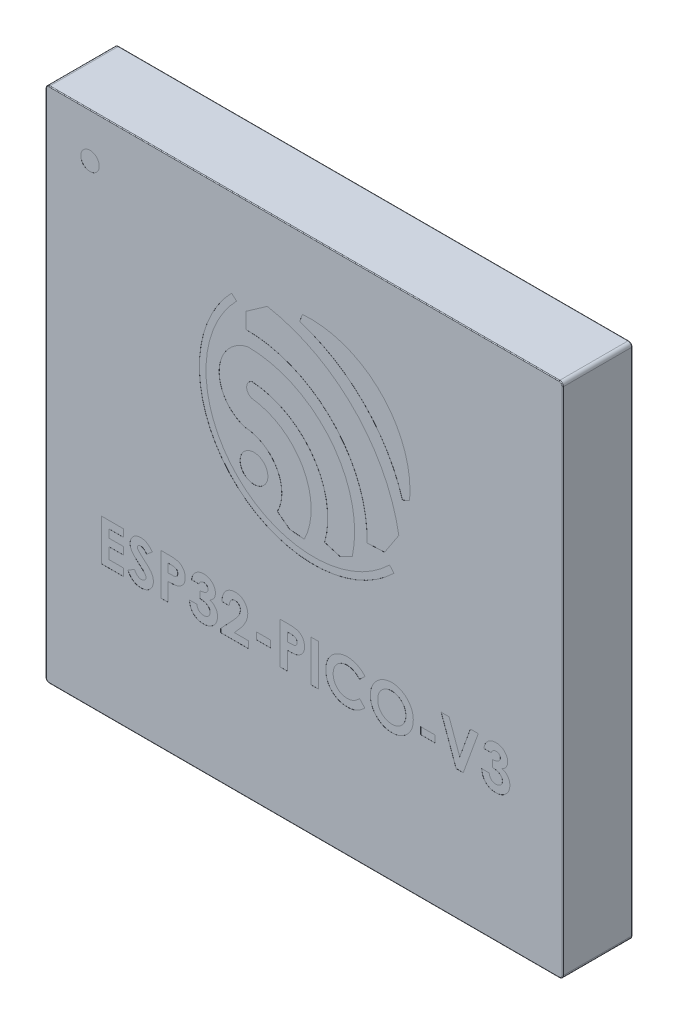
from build123d import *

# Parameters (mm, degrees)
SKETCH1_W             = 7
SKETCH1_H             = 7
BOSS_EXTRUDE1_DEPTH   = 0.94
FILLET1_R             = 0.05
FILLET2_R             = 0.01
SKETCH2_W             = 0.25
SKETCH2_H             = 0.4
SKETCH2_W_2           = 0.4
SKETCH2_H_2           = 0.25
BOSS_EXTRUDE2_DEPTH   = 0.025
SKETCH3_R             = 0.125
SKETCH3_R_2           = 0.188076001
SKETCH3_W             = 0.193846154
SKETCH3_H             = 0.093333333
SKETCH3_W_2           = 0.10051282
SKETCH3_H_2           = 0.56
CUT_EXTRUDE1_DEPTH    = 0.001
BODY_MOVE_COPY1_ANGLE = 180


with BuildPart() as part:
    # Sketch1 → Boss-Extrude1 (new body)
    with BuildSketch(Plane(origin=(0, 0, 0), x_dir=(1, 0, 0), z_dir=(0, 1, 0))):
        Rectangle(SKETCH1_W, SKETCH1_H)
    extrude(amount=BOSS_EXTRUDE1_DEPTH)

    # Fillet1
    fillet1_edges = [part.edges().sort_by_distance(p)[0] for p in [
        (3.5, 0.47, -3.5),
        (3.5, 0.47, 3.5),
        (-3.5, 0.47, 3.5),
        (-3.5, 0.47, -3.5),
    ]]
    fillet(fillet1_edges, radius=FILLET1_R)

    # Fillet2
    fillet2_edges = [part.edges().sort_by_distance(p)[0] for p in [
        (3.485355339, 0.94, 3.485355339),
        (0, 0.94, 3.5),
        (-3.485355339, 0.94, 3.485355339),
        (-3.5, 0.94, 0),
        (-3.485355339, 0.94, -3.485355339),
        (0, 0.94, -3.5),
        (3.485355339, 0.94, -3.485355339),
        (3.5, 0.94, 0),
        (3.5, 0, 0),
        (3.485355339, 0, -3.485355339),
        (0, 0, -3.5),
        (3.485355339, 0, 3.485355339),
        (0, 0, 3.5),
        (-3.485355339, 0, 3.485355339),
        (-3.5, 0, 0),
        (-3.485355339, 0, -3.485355339),
    ]]
    fillet(fillet2_edges, radius=FILLET2_R)

    # Sketch2 → Boss-Extrude2 (add)
    with BuildSketch(Plane.XZ):
        with BuildLine():
            Line((2.175, 2.475), (2.475, 2.175))
            Line((2.475, 2.175), (2.475, -2.425))
            ThreePointArc((2.475, -2.425), (2.460355339, -2.460355339), (2.425, -2.475))
            Line((2.425, -2.475), (-2.425, -2.475))
            ThreePointArc((-2.425, -2.475), (-2.460355339, -2.460355339), (-2.475, -2.425))
            Line((-2.475, -2.425), (-2.475, 2.425))
            ThreePointArc((-2.475, 2.425), (-2.460355339, 2.460355339), (-2.425, 2.475))
            Line((-2.425, 2.475), (2.175, 2.475))
        make_face()
        with Locations((-0.25, 3.225)):
            Rectangle(SKETCH2_W, SKETCH2_H)
        with Locations((-0.75, 3.225)):
            Rectangle(SKETCH2_W, SKETCH2_H)
        with Locations((-1.25, 3.225)):
            Rectangle(SKETCH2_W, SKETCH2_H)
        with Locations((-1.75, 3.225)):
            Rectangle(SKETCH2_W, SKETCH2_H)
        with Locations((-2.25, 3.225)):
            Rectangle(SKETCH2_W, SKETCH2_H)
        with Locations((-2.75, 3.225)):
            Rectangle(SKETCH2_W, SKETCH2_H)
        with Locations((2.75, 3.225)):
            Rectangle(SKETCH2_W, SKETCH2_H)
        with Locations((2.25, 3.225)):
            Rectangle(SKETCH2_W, SKETCH2_H)
        with Locations((1.75, 3.225)):
            Rectangle(SKETCH2_W, SKETCH2_H)
        with Locations((1.25, 3.225)):
            Rectangle(SKETCH2_W, SKETCH2_H)
        with Locations((0.75, 3.225)):
            Rectangle(SKETCH2_W, SKETCH2_H)
        with Locations((0.25, 3.225)):
            Rectangle(SKETCH2_W, SKETCH2_H)
        with Locations((0.25, -3.225)):
            Rectangle(SKETCH2_W, SKETCH2_H)
        with Locations((0.75, -3.225)):
            Rectangle(SKETCH2_W, SKETCH2_H)
        with Locations((1.25, -3.225)):
            Rectangle(SKETCH2_W, SKETCH2_H)
        with Locations((1.75, -3.225)):
            Rectangle(SKETCH2_W, SKETCH2_H)
        with Locations((2.25, -3.225)):
            Rectangle(SKETCH2_W, SKETCH2_H)
        with Locations((2.75, -3.225)):
            Rectangle(SKETCH2_W, SKETCH2_H)
        with Locations((-2.75, -3.225)):
            Rectangle(SKETCH2_W, SKETCH2_H)
        with Locations((-2.25, -3.225)):
            Rectangle(SKETCH2_W, SKETCH2_H)
        with Locations((-1.75, -3.225)):
            Rectangle(SKETCH2_W, SKETCH2_H)
        with Locations((-1.25, -3.225)):
            Rectangle(SKETCH2_W, SKETCH2_H)
        with Locations((-0.75, -3.225)):
            Rectangle(SKETCH2_W, SKETCH2_H)
        with Locations((-0.25, -3.225)):
            Rectangle(SKETCH2_W, SKETCH2_H)
        with Locations((3.225, 0.25)):
            Rectangle(SKETCH2_W_2, SKETCH2_H_2)
        with Locations((3.225, 0.75)):
            Rectangle(SKETCH2_W_2, SKETCH2_H_2)
        with Locations((3.225, 1.25)):
            Rectangle(SKETCH2_W_2, SKETCH2_H_2)
        with Locations((3.225, 1.75)):
            Rectangle(SKETCH2_W_2, SKETCH2_H_2)
        with Locations((3.225, 2.25)):
            Rectangle(SKETCH2_W_2, SKETCH2_H_2)
        with Locations((3.225, 2.75)):
            Rectangle(SKETCH2_W_2, SKETCH2_H_2)
        with Locations((3.225, -2.75)):
            Rectangle(SKETCH2_W_2, SKETCH2_H_2)
        with Locations((3.225, -2.25)):
            Rectangle(SKETCH2_W_2, SKETCH2_H_2)
        with Locations((3.225, -1.75)):
            Rectangle(SKETCH2_W_2, SKETCH2_H_2)
        with Locations((3.225, -1.25)):
            Rectangle(SKETCH2_W_2, SKETCH2_H_2)
        with Locations((3.225, -0.75)):
            Rectangle(SKETCH2_W_2, SKETCH2_H_2)
        with Locations((3.225, -0.25)):
            Rectangle(SKETCH2_W_2, SKETCH2_H_2)
        with Locations((-3.225, -0.25)):
            Rectangle(SKETCH2_W_2, SKETCH2_H_2)
        with Locations((-3.225, -0.75)):
            Rectangle(SKETCH2_W_2, SKETCH2_H_2)
        with Locations((-3.225, -1.25)):
            Rectangle(SKETCH2_W_2, SKETCH2_H_2)
        with Locations((-3.225, -1.75)):
            Rectangle(SKETCH2_W_2, SKETCH2_H_2)
        with Locations((-3.225, -2.25)):
            Rectangle(SKETCH2_W_2, SKETCH2_H_2)
        with Locations((-3.225, -2.75)):
            Rectangle(SKETCH2_W_2, SKETCH2_H_2)
        with Locations((-3.225, 2.75)):
            Rectangle(SKETCH2_W_2, SKETCH2_H_2)
        with Locations((-3.225, 2.25)):
            Rectangle(SKETCH2_W_2, SKETCH2_H_2)
        with Locations((-3.225, 1.75)):
            Rectangle(SKETCH2_W_2, SKETCH2_H_2)
        with Locations((-3.225, 1.25)):
            Rectangle(SKETCH2_W_2, SKETCH2_H_2)
        with Locations((-3.225, 0.75)):
            Rectangle(SKETCH2_W_2, SKETCH2_H_2)
        with Locations((-3.225, 0.25)):
            Rectangle(SKETCH2_W_2, SKETCH2_H_2)
    extrude(amount=BOSS_EXTRUDE2_DEPTH)

    # Sketch3 → Cut-Extrude1 (cut)
    # profile 1 of 19: a face of its own
    with BuildSketch(Plane(origin=(0, 0.94, 0), x_dir=(1, 0, 0), z_dir=(0, 1, 0))):
        with Locations((2.9, -2.9)):
            Circle(SKETCH3_R)
    # profile 2 of 19: a face of its own
    with BuildSketch(Plane(origin=(0, 0.94, 0), x_dir=(1, 0, 0), z_dir=(0, 1, 0))):
        with Locations((0.680465869, -0.405591689)):
            Circle(SKETCH3_R_2)
    # profile 3 of 19: a face of its own
    with BuildSketch(Plane(origin=(0, 0.94, 0), x_dir=(1, 0, 0), z_dir=(0, 1, 0))):
        with BuildLine():
            Line((-1.329066131, -1.038515513), (-1.425708131, -1.079675513))
            ThreePointArc((-1.425708131, -1.079675513), (-1.039396996, -2.146594255), (0.025516006, -2.538400574))
            Line((0.025516006, -2.538400574), (0.062351869, -2.435729513))
            ThreePointArc((0.062351869, -2.435729513), (-0.807548499, -1.910591291), (-1.329066131, -1.038515513))
        make_face()
    # profile 4 of 19: a face of its own
    with BuildSketch(Plane(origin=(0, 0.94, 0), x_dir=(1, 0, 0), z_dir=(0, 1, 0))):
        with BuildLine():
            Line((-0.849006132, -0.296668387), (-1.087188132, -0.306874387))
            Line((-1.087188132, -0.306874387), (-1.279674132, -0.600748387))
            ThreePointArc((-1.279674132, -0.600748387), (-0.671967645, -1.778283582), (0.500946606, -2.394861614))
            Line((0.500946606, -2.394861614), (0.789906606, -2.192127614))
            Line((0.789906606, -2.192127614), (0.789906606, -1.979145614))
            ThreePointArc((0.789906606, -1.979145614), (-0.384973249, -1.484127484), (-0.849006132, -0.296668387))
        make_face()
    # profile 5 of 19: a face of its own
    with BuildSketch(Plane(origin=(0, 0.94, 0), x_dir=(1, 0, 0), z_dir=(0, 1, 0))):
        with BuildLine():
            Line((0.916505869, -2.248829513), (0.983831869, -2.308385513))
            ThreePointArc((0.983831869, -2.308385513), (0.962870462, -0.13150162), (-1.214102193, -0.124226816))
            Line((-1.214102193, -0.124226816), (-1.154228408, -0.191279923))
            ThreePointArc((-1.154228408, -0.191279923), (0.899527006, -0.195140655), (0.916505869, -2.248829513))
        make_face()
    # profile 6 of 19: a face of its own
    with BuildSketch(Plane(origin=(0, 0.94, 0), x_dir=(1, 0, 0), z_dir=(0, 1, 0))):
        with BuildLine():
            Line((0.364251232, -0.058565655), (0.198519232, 0.066846345))
            Line((0.198519232, 0.066846345), (-0.000476768, 0.084360345))
            ThreePointArc((-0.000476768, 0.084360345), (0.017660774, -0.747935784), (0.709197662, -1.21142532))
            ThreePointArc((0.709197662, -1.21142532), (0.779600706, -1.311524275), (0.705482082, -1.408904042))
            ThreePointArc((0.705482082, -1.408904042), (-0.118148182, -0.947937237), (-0.275155251, -0.017235357))
            Line((-0.275155251, -0.017235357), (-0.485491251, 0.045386643))
            Line((-0.485491251, 0.045386643), (-0.649358418, -0.036630846))
            ThreePointArc((-0.649358418, -0.036630846), (-0.360274374, -1.25078894), (0.765772749, -1.789089357))
            ThreePointArc((0.765772749, -1.789089357), (1.152134339, -1.323910603), (0.807057077, -0.827334089))
            ThreePointArc((0.807057077, -0.827334089), (0.374300948, -0.564688007), (0.364251232, -0.058565655))
        make_face()
    # profile 7 of 19: a face of its own
    with BuildSketch(Plane(origin=(0, 0.94, 0), x_dir=(1, 0, 0), z_dir=(0, 1, 0))):
        with BuildLine():
            Line((-2.530769231, 1.321410256), (-2.43025641, 1.321410256))
            add(Edge.make_bspline(
                [(-2.43025641, 1.321410256), (-2.430961642, 1.31638488), (-2.432339134, 1.306569075), (-2.435725388, 1.29232424), (-2.439641386, 1.278778454), (-2.444649393, 1.266004411), (-2.450430234, 1.254015882), (-2.457171479, 1.242802139), (-2.46456033, 1.232202256), (-2.470345338, 1.225850074), (-2.473221154, 1.222692308)],
                knots=[0, 0, 0, 0, 1.1115466, 2.171125598, 3.205689823, 4.19946166, 5.17440286, 6.118867946, 7.064860634, 8, 8, 8, 8], degree=3))
            add(Edge.make_bspline(
                [(-2.473221154, 1.222692308), (-2.477358907, 1.218519423), (-2.485513983, 1.210295105), (-2.499142073, 1.199760662), (-2.513426827, 1.190643818), (-2.528654734, 1.183415918), (-2.544588834, 1.17756577), (-2.561355843, 1.173636213), (-2.578887244, 1.171028917), (-2.590850219, 1.170772089), (-2.596955128, 1.170641026)],
                knots=[0, 0, 0, 0, 1.01925491, 2.00884431, 2.983262333, 3.955970413, 4.92937149, 5.924503185, 6.940838805, 8, 8, 8, 8], degree=3))
            add(Edge.make_bspline(
                [(-2.596955128, 1.170641026), (-2.602382706, 1.17076916), (-2.613052232, 1.171021047), (-2.628733749, 1.173043056), (-2.643684764, 1.176589434), (-2.658063312, 1.181226244), (-2.671657932, 1.187535399), (-2.684768671, 1.194858985), (-2.697029214, 1.203841667), (-2.708468248, 1.213991195), (-2.718977183, 1.224968902), (-2.728077966, 1.236703169), (-2.735902073, 1.248880545), (-2.742348102, 1.261602201), (-2.747304223, 1.274889666), (-2.750743917, 1.288666177), (-2.752995281, 1.302901337), (-2.753219576, 1.312576783), (-2.753333333, 1.317483974)],
                knots=[0, 0, 0, 0, 1.091422571, 2.145516843, 3.172569842, 4.178562979, 5.178154469, 6.181868002, 7.194278174, 8.227918432, 9.254613415, 10.245994977, 11.209837596, 12.161663635, 13.10878368, 14.055455738, 15.013766427, 16, 16, 16, 16], degree=3))
            add(Edge.make_bspline(
                [(-2.753333333, 1.317483974), (-2.753095401, 1.323560043), (-2.752625551, 1.335558597), (-2.748909723, 1.35308482), (-2.742936318, 1.369804956), (-2.734443021, 1.385520895), (-2.723777295, 1.400216266), (-2.710697804, 1.413377824), (-2.695569545, 1.425209401), (-2.684212874, 1.431567771), (-2.678397436, 1.434823718)],
                knots=[0, 0, 0, 0, 0.992776698, 1.96045919, 2.915875678, 3.886951799, 4.871409521, 5.874469288, 6.911574252, 8, 8, 8, 8], degree=3))
            add(Edge.make_bspline(
                [(-2.678397436, 1.434823718), (-2.682389213, 1.436134086), (-2.690232875, 1.438708901), (-2.70137945, 1.443783103), (-2.711987293, 1.44931658), (-2.721813807, 1.455776324), (-2.73112846, 1.462714593), (-2.73963655, 1.470504437), (-2.74755839, 1.478945903), (-2.754698004, 1.488128793), (-2.761081151, 1.497900429), (-2.766706555, 1.50808518), (-2.771427326, 1.518720269), (-2.775389446, 1.529727542), (-2.778412434, 1.541215331), (-2.780539215, 1.553144704), (-2.781768948, 1.565486917), (-2.781956466, 1.573848817), (-2.782051282, 1.578076923)],
                knots=[0, 0, 0, 0, 1.059375415, 2.081625174, 3.086260357, 4.075579879, 5.045586876, 6.014170127, 6.982201689, 7.963705737, 8.945119069, 9.924852636, 10.896327119, 11.878239286, 12.873838556, 13.889973282, 14.933087432, 16, 16, 16, 16], degree=3))
            add(Edge.make_bspline(
                [(-2.782051282, 1.578076923), (-2.781875525, 1.584293248), (-2.78152882, 1.596555783), (-2.778882322, 1.614558426), (-2.774631604, 1.631814742), (-2.76865946, 1.648346481), (-2.760840048, 1.664103997), (-2.7513958, 1.67919325), (-2.740211331, 1.693495675), (-2.727456219, 1.706884554), (-2.713409826, 1.719171723), (-2.698278402, 1.730017034), (-2.682052447, 1.738959927), (-2.665119002, 1.746603029), (-2.647098002, 1.752275589), (-2.628222181, 1.756429633), (-2.608353807, 1.758957092), (-2.594793788, 1.759223115), (-2.58786859, 1.759358974)],
                knots=[0, 0, 0, 0, 1.005301618, 1.9830924, 2.936709333, 3.876255674, 4.820386332, 5.77704884, 6.75110905, 7.752325838, 8.764085485, 9.766124222, 10.757295257, 11.756573224, 12.766631673, 13.80722022, 14.880131728, 16, 16, 16, 16], degree=3))
            add(Edge.make_bspline(
                [(-2.58786859, 1.759358974), (-2.581317303, 1.759216098), (-2.568507129, 1.758936721), (-2.54976993, 1.756517437), (-2.531960625, 1.752617633), (-2.515040152, 1.747111183), (-2.499080547, 1.740016724), (-2.483988831, 1.731453593), (-2.469929758, 1.721159416), (-2.456838603, 1.709377071), (-2.444826348, 1.696340051), (-2.434357199, 1.68194209), (-2.425246279, 1.666497797), (-2.417433459, 1.649973957), (-2.411329134, 1.632223135), (-2.406474525, 1.613403851), (-2.403094746, 1.59343473), (-2.402063997, 1.579696731), (-2.401538462, 1.572692308)],
                knots=[0, 0, 0, 0, 1.066693477, 2.085777942, 3.071407889, 4.032495163, 4.978645371, 5.911608997, 6.853298848, 7.810770565, 8.776420673, 9.735131334, 10.704462168, 11.693492242, 12.70668109, 13.756973703, 14.856375978, 16, 16, 16, 16], degree=3))
            Line((-2.401538462, 1.572692308), (-2.502051282, 1.572692308))
            add(Edge.make_bspline(
                [(-2.502051282, 1.572692308), (-2.502688346, 1.576214216), (-2.503929194, 1.583074056), (-2.506347204, 1.593006556), (-2.509506495, 1.602171259), (-2.513118503, 1.610635496), (-2.517112001, 1.618486133), (-2.52188354, 1.625513229), (-2.526999688, 1.631992951), (-2.534690423, 1.639440955), (-2.545420762, 1.647251761), (-2.559949009, 1.654169369), (-2.576184034, 1.658103673), (-2.587510908, 1.658593157), (-2.593365385, 1.658846154)],
                knots=[0, 0, 0, 0, 0.928450228, 1.808400301, 2.64896863, 3.43999153, 4.194978884, 4.9294959, 5.640047715, 6.332896648, 7.70085756, 9.063442004, 10.482192841, 12, 12, 12, 12], degree=3))
            add(Edge.make_bspline(
                [(-2.593365385, 1.658846154), (-2.596472455, 1.658792688), (-2.60255851, 1.658687961), (-2.611499487, 1.657533761), (-2.620011412, 1.655619089), (-2.628183199, 1.653049077), (-2.635903386, 1.649660046), (-2.643270671, 1.645629814), (-2.650153964, 1.640730342), (-2.656574946, 1.635205485), (-2.66238599, 1.629121647), (-2.667641759, 1.622766676), (-2.671860029, 1.615880904), (-2.675361537, 1.608736641), (-2.678249859, 1.601335735), (-2.680061986, 1.593509792), (-2.681418695, 1.58541567), (-2.681498141, 1.57987786), (-2.681538462, 1.577067308)],
                knots=[0, 0, 0, 0, 1.110416125, 2.175056767, 3.216269732, 4.226816172, 5.232753079, 6.226173397, 7.223992381, 8.247806573, 9.250094092, 10.229378924, 11.190237183, 12.128982156, 13.072570213, 14.022671385, 14.996464856, 16, 16, 16, 16], degree=3))
            add(Edge.make_bspline(
                [(-2.681538462, 1.577067308), (-2.681436084, 1.573992444), (-2.6812335, 1.567907875), (-2.679450764, 1.55899123), (-2.676782271, 1.550380922), (-2.672944484, 1.542147992), (-2.667922568, 1.53434086), (-2.661816433, 1.526894865), (-2.654570842, 1.519869291), (-2.646428429, 1.513059525), (-2.637060664, 1.507098287), (-2.62684583, 1.501608879), (-2.615532277, 1.497237957), (-2.603391419, 1.493334868), (-2.590194979, 1.490483874), (-2.576024504, 1.488413844), (-2.56090297, 1.486873006), (-2.550479494, 1.48665195), (-2.545128205, 1.486538462)],
                knots=[0, 0, 0, 0, 0.809868251, 1.602574917, 2.388262527, 3.182133002, 3.988875265, 4.829537611, 5.714850619, 6.646378958, 7.622533229, 8.636771727, 9.698525113, 10.814716514, 11.996253919, 13.252421425, 14.589425562, 16, 16, 16, 16], degree=3))
            Line((-2.545128205, 1.486538462), (-2.545128205, 1.393205128))
            add(Edge.make_bspline(
                [(-2.545128205, 1.393205128), (-2.551791547, 1.392639313), (-2.564257339, 1.391580786), (-2.581550737, 1.389079115), (-2.596186943, 1.385808292), (-2.608323287, 1.381618366), (-2.618551504, 1.376701252), (-2.62725918, 1.370867557), (-2.63501118, 1.364408107), (-2.641340134, 1.356988747), (-2.646454513, 1.349156802), (-2.650075869, 1.340933841), (-2.652479767, 1.332502667), (-2.652707614, 1.326735729), (-2.652820513, 1.323878205)],
                knots=[0, 0, 0, 0, 1.700278244, 3.18088388, 4.44026007, 5.507838349, 6.439172496, 7.317391478, 8.167251366, 8.996486918, 9.787781501, 10.536992524, 11.275078289, 12, 12, 12, 12], degree=3))
            add(Edge.make_bspline(
                [(-2.652820513, 1.323878205), (-2.652630223, 1.320229987), (-2.652258818, 1.313109438), (-2.649240221, 1.302943573), (-2.644335852, 1.293731269), (-2.63743063, 1.285790118), (-2.628981934, 1.279233465), (-2.619139594, 1.274454531), (-2.608070482, 1.271595999), (-2.600300522, 1.271304568), (-2.596282051, 1.271153846)],
                knots=[0, 0, 0, 0, 1.008776249, 1.968917671, 2.909425455, 3.878736958, 4.86052431, 5.85160606, 6.888892716, 8, 8, 8, 8], degree=3))
            add(Edge.make_bspline(
                [(-2.596282051, 1.271153846), (-2.592639937, 1.271332707), (-2.585412866, 1.271687623), (-2.574848991, 1.274348407), (-2.564828385, 1.278782228), (-2.555608036, 1.285008571), (-2.547210619, 1.292409334), (-2.540169556, 1.301103458), (-2.534437695, 1.310750882), (-2.531996846, 1.317843202), (-2.530769231, 1.321410256)],
                knots=[0, 0, 0, 0, 0.988439209, 1.961366134, 2.938893463, 3.950078543, 4.971412263, 5.967491143, 6.977757845, 8, 8, 8, 8], degree=3))
        make_face()
    # profile 8 of 19: a face of its own
    with BuildSketch(Plane(origin=(0, 0.94, 0), x_dir=(1, 0, 0), z_dir=(0, 1, 0))):
        Polygon((-1.852307692, 1.185), (-1.959663462, 1.185), (-2.103589744, 1.582788462), (-2.247852564, 1.185), (-2.354871795, 1.185), (-2.151826923, 1.745), (-2.055016026, 1.745), align=None)
    # profile 9 of 19: a face of its own
    with BuildSketch(Plane(origin=(0, 0.94, 0), x_dir=(1, 0, 0), z_dir=(0, 1, 0))):
        with Locations((-1.672820513, 1.540384616)):
            Rectangle(SKETCH3_W, SKETCH3_H)
    # profile 10 of 19: a face of its own
    with BuildSketch(Plane(origin=(0, 0.94, 0), x_dir=(1, 0, 0), z_dir=(0, 1, 0))):
        with BuildLine():
            add(Edge.make_bspline(
                [(-1.185737179, 1.170641026), (-1.195473514, 1.170893014), (-1.214695245, 1.171390497), (-1.242962632, 1.175540529), (-1.270206754, 1.18229463), (-1.296431514, 1.191722266), (-1.321547475, 1.2039319), (-1.345646918, 1.218756771), (-1.368663801, 1.236322673), (-1.390329771, 1.256378939), (-1.410196935, 1.27830984), (-1.427660398, 1.301691339), (-1.442484664, 1.326282033), (-1.454517557, 1.352086713), (-1.463914378, 1.379069933), (-1.470445058, 1.407241934), (-1.474655886, 1.43656664), (-1.475139055, 1.456534456), (-1.475384615, 1.466682692)],
                knots=[0, 0, 0, 0, 1.014151002, 2.002163778, 2.969868608, 3.93493411, 4.9003771, 5.874719092, 6.87846472, 7.912488755, 8.947011879, 9.957751389, 10.948740761, 11.933621513, 12.919426746, 13.920294397, 14.943031967, 16, 16, 16, 16], degree=3))
            add(Edge.make_bspline(
                [(-1.475384615, 1.466682692), (-1.475123021, 1.476716562), (-1.474607542, 1.496488624), (-1.470617472, 1.525543366), (-1.463973287, 1.553412575), (-1.454757625, 1.580105778), (-1.442935129, 1.605623413), (-1.428337258, 1.629882678), (-1.41105992, 1.652933418), (-1.391456041, 1.674634416), (-1.370007019, 1.694460593), (-1.347153475, 1.711865542), (-1.323107728, 1.72650471), (-1.298023412, 1.738655534), (-1.271663883, 1.747786532), (-1.244321389, 1.754621111), (-1.215767201, 1.758573241), (-1.196368729, 1.759094429), (-1.186522436, 1.759358974)],
                knots=[0, 0, 0, 0, 1.051517626, 2.07204922, 3.067438659, 4.05042616, 5.027204762, 6.009981242, 7.012629434, 8.042243656, 9.071350414, 10.070091277, 11.048190212, 12.017682766, 12.985867053, 13.966945899, 14.968060614, 16, 16, 16, 16], degree=3))
            add(Edge.make_bspline(
                [(-1.186522436, 1.759358974), (-1.176223597, 1.759124446), (-1.155987785, 1.758663631), (-1.126365233, 1.754318455), (-1.098024718, 1.747693656), (-1.071043893, 1.738102541), (-1.045443732, 1.725640222), (-1.021109431, 1.710592923), (-0.998224004, 1.692669985), (-0.976863735, 1.672411993), (-0.957513534, 1.650239559), (-0.940432597, 1.62681784), (-0.926024596, 1.602323961), (-0.91428879, 1.576746926), (-0.905036762, 1.550245569), (-0.898510505, 1.52265852), (-0.894655289, 1.494051935), (-0.89411828, 1.474621771), (-0.893846154, 1.464775641)],
                knots=[0, 0, 0, 0, 1.067953136, 2.098381936, 3.099641766, 4.083805132, 5.062469929, 6.048665414, 7.046702845, 8.073106546, 9.098695993, 10.09591865, 11.076726721, 12.041940862, 13.011263376, 13.984305721, 14.978557872, 16, 16, 16, 16], degree=3))
            add(Edge.make_bspline(
                [(-0.893846154, 1.464775641), (-0.893932741, 1.458151967), (-0.894104819, 1.444988491), (-0.89613217, 1.425475827), (-0.899138978, 1.406371992), (-0.903255227, 1.387641062), (-0.908801183, 1.369331307), (-0.915541841, 1.351396543), (-0.923396833, 1.333836868), (-0.932455005, 1.316811084), (-0.942701604, 1.300522896), (-0.953642207, 1.284830043), (-0.965695863, 1.270144491), (-0.978613778, 1.256306721), (-0.992446551, 1.243379988), (-1.007218273, 1.231320153), (-1.022905695, 1.220157974), (-1.039339134, 1.209801215), (-1.056462377, 1.200730302), (-1.07386803, 1.192508185), (-1.091723183, 1.185841694), (-1.109898198, 1.180320296), (-1.128351288, 1.17588915), (-1.147224927, 1.172942816), (-1.166359826, 1.170899449), (-1.179262733, 1.170727371), (-1.185737179, 1.170641026)],
                knots=[0, 0, 0, 0, 1.034641744, 2.056182551, 3.061960284, 4.05571729, 5.050247014, 6.048716841, 7.047801973, 8.054190544, 9.059424999, 10.053182006, 11.041513076, 12.025412457, 13.009311837, 13.997642908, 15.002928308, 16.016213968, 17.030509951, 18.02913364, 19.022134519, 20.005478534, 20.996155877, 21.984625117, 22.988721131, 24, 24, 24, 24], degree=3))
        make_face()
        with BuildLine():
            add(Edge.make_bspline(
                [(-1.184166667, 1.271153846), (-1.177614148, 1.271329665), (-1.164682097, 1.271676662), (-1.145713128, 1.274320298), (-1.12750227, 1.278542503), (-1.110150373, 1.284658257), (-1.093582594, 1.292442269), (-1.077768213, 1.301866399), (-1.062931353, 1.313258194), (-1.048854399, 1.325992441), (-1.036181071, 1.340239933), (-1.024786033, 1.355342194), (-1.015572682, 1.37166261), (-1.007650516, 1.388663631), (-1.001798771, 1.406775195), (-0.997343277, 1.425703352), (-0.994916521, 1.445642414), (-0.994547471, 1.459198079), (-0.994358974, 1.466121795)],
                knots=[0, 0, 0, 0, 1.033668485, 2.040047952, 3.016132939, 3.979056467, 4.937231767, 5.900589077, 6.877725736, 7.88429546, 8.891280164, 9.882584218, 10.863295226, 11.842887319, 12.837417301, 13.860812229, 14.907384602, 16, 16, 16, 16], degree=3))
            add(Edge.make_bspline(
                [(-0.994358974, 1.466121795), (-0.994588101, 1.473796966), (-0.995037152, 1.488839031), (-0.998150761, 1.510793751), (-1.003606411, 1.531503952), (-1.011059486, 1.551038914), (-1.020966749, 1.569193216), (-1.032816058, 1.586186949), (-1.046904096, 1.601914676), (-1.057738334, 1.611104829), (-1.063237179, 1.615769231)],
                knots=[0, 0, 0, 0, 1.078343132, 2.113373867, 3.107373148, 4.082093053, 5.043582658, 6.005574554, 6.987742499, 8, 8, 8, 8], degree=3))
            add(Edge.make_bspline(
                [(-1.063237179, 1.615769231), (-1.067742984, 1.619214565), (-1.076653077, 1.62602761), (-1.090875524, 1.634759924), (-1.105521845, 1.642244389), (-1.120702563, 1.648291747), (-1.136385618, 1.653048498), (-1.15256886, 1.656379573), (-1.169229357, 1.65847011), (-1.180495966, 1.658719969), (-1.186185897, 1.658846154)],
                knots=[0, 0, 0, 0, 1.023928204, 2.024787132, 3.009472467, 3.9914905, 4.972207045, 5.96565515, 6.972602802, 8, 8, 8, 8], degree=3))
            add(Edge.make_bspline(
                [(-1.186185897, 1.658846154), (-1.192625621, 1.658668592), (-1.20529598, 1.658319235), (-1.223913611, 1.655711735), (-1.241741593, 1.651279593), (-1.258945174, 1.645260903), (-1.275293984, 1.637194818), (-1.291042971, 1.627616959), (-1.306004434, 1.616228616), (-1.319995983, 1.603173454), (-1.332818489, 1.588925291), (-1.344162839, 1.573741343), (-1.353557831, 1.557621021), (-1.36139445, 1.540779656), (-1.367500049, 1.523083157), (-1.371678446, 1.504530188), (-1.374363822, 1.485195602), (-1.374700353, 1.472039005), (-1.374871795, 1.465336538)],
                knots=[0, 0, 0, 0, 1.026350473, 2.019376834, 2.989435443, 3.95094063, 4.91865229, 5.889827372, 6.885283771, 7.910196595, 8.935871797, 9.9372888, 10.925850568, 11.904605667, 12.894245083, 13.903507864, 14.931967858, 16, 16, 16, 16], degree=3))
            add(Edge.make_bspline(
                [(-1.374871795, 1.465336538), (-1.374695085, 1.458672338), (-1.37434726, 1.445554875), (-1.371725148, 1.426273926), (-1.367365975, 1.4078229), (-1.361205072, 1.390154234), (-1.353529868, 1.37317517), (-1.343888534, 1.35703307), (-1.332490051, 1.341741902), (-1.319542792, 1.327392573), (-1.305452815, 1.314205575), (-1.290325206, 1.302761882), (-1.274583975, 1.292817619), (-1.257867754, 1.285027699), (-1.24051859, 1.278821482), (-1.222430606, 1.274251136), (-1.203535296, 1.271695233), (-1.190680425, 1.271335917), (-1.184166667, 1.271153846)],
                knots=[0, 0, 0, 0, 1.055040155, 2.076685641, 3.074845078, 4.052329834, 5.035358467, 6.020382375, 7.023447318, 8.050688466, 9.077178457, 10.074336316, 11.0503314, 12.019748348, 12.988025369, 13.964577102, 14.968620271, 16, 16, 16, 16], degree=3))
        make_face(mode=Mode.SUBTRACT)
    # profile 11 of 19: a face of its own
    with BuildSketch(Plane(origin=(0, 0.94, 0), x_dir=(1, 0, 0), z_dir=(0, 1, 0))):
        with BuildLine():
            Line((-0.822051282, 1.282147436), (-0.748349359, 1.352596154))
            add(Edge.make_bspline(
                [(-0.748349359, 1.352596154), (-0.742104639, 1.346122155), (-0.729886887, 1.333455823), (-0.710105876, 1.316874214), (-0.689770186, 1.302781928), (-0.668822896, 1.291295713), (-0.647276041, 1.28218016), (-0.625092131, 1.275821154), (-0.602324755, 1.271817148), (-0.586939581, 1.271376175), (-0.579182692, 1.271153846)],
                knots=[0, 0, 0, 0, 1.115370381, 2.182214363, 3.196266025, 4.180416361, 5.141116029, 6.092551847, 7.038303877, 8, 8, 8, 8], degree=3))
            add(Edge.make_bspline(
                [(-0.579182692, 1.271153846), (-0.572705609, 1.271332938), (-0.559923798, 1.271686356), (-0.541158524, 1.274283499), (-0.523201764, 1.278683397), (-0.506039271, 1.284799222), (-0.489586193, 1.292501097), (-0.473995736, 1.302181798), (-0.459184115, 1.313518221), (-0.445324393, 1.326490528), (-0.432812062, 1.340768602), (-0.421538274, 1.355805973), (-0.412200274, 1.371868617), (-0.404577674, 1.38872229), (-0.398570891, 1.406373079), (-0.394307636, 1.4248201), (-0.391837503, 1.444105002), (-0.391469222, 1.457215211), (-0.391282051, 1.463878205)],
                knots=[0, 0, 0, 0, 1.035268443, 2.04298821, 3.02163646, 3.985902049, 4.951223231, 5.920091634, 6.913651787, 7.92868536, 8.949353712, 9.945284791, 10.92850487, 11.913014323, 12.897904816, 13.904240668, 14.934873455, 16, 16, 16, 16], degree=3))
            add(Edge.make_bspline(
                [(-0.391282051, 1.463878205), (-0.391336762, 1.468554623), (-0.391444598, 1.477771939), (-0.392595268, 1.491371876), (-0.394506253, 1.504595564), (-0.397186562, 1.517403823), (-0.400560841, 1.529851904), (-0.404690639, 1.541858727), (-0.40968396, 1.553439696), (-0.415272317, 1.564655477), (-0.421510116, 1.575411032), (-0.428502403, 1.585563733), (-0.436170824, 1.595034687), (-0.444208538, 1.604153452), (-0.453147865, 1.612386384), (-0.46258856, 1.620187211), (-0.472666079, 1.627362679), (-0.483368183, 1.633812931), (-0.494375428, 1.639824454), (-0.505913367, 1.64480277), (-0.517659587, 1.649277979), (-0.529820155, 1.652644683), (-0.542180864, 1.655573004), (-0.554913763, 1.65736142), (-0.567898013, 1.65872038), (-0.576673572, 1.658804049), (-0.581089744, 1.658846154)],
                knots=[0, 0, 0, 0, 1.103833241, 2.175677997, 3.219414644, 4.256521947, 5.263082927, 6.262573145, 7.25136242, 8.238376666, 9.219530388, 10.184343756, 11.145312504, 12.095474572, 13.051075647, 14.010745898, 14.985684176, 15.968306307, 16.959653902, 17.943861036, 18.93268972, 19.924626761, 20.920484516, 21.929288403, 22.957944781, 24, 24, 24, 24], degree=3))
            add(Edge.make_bspline(
                [(-0.581089744, 1.658846154), (-0.58858046, 1.658629978), (-0.60329777, 1.658205248), (-0.624894356, 1.654869419), (-0.645532998, 1.649406865), (-0.661990833, 1.642836483), (-0.674868307, 1.636449133), (-0.684666704, 1.630625591), (-0.694756211, 1.624029159), (-0.70506775, 1.616477105), (-0.715657138, 1.608059303), (-0.726342458, 1.598599809), (-0.737395788, 1.588407686), (-0.744636772, 1.581133471), (-0.748349359, 1.577403846)],
                knots=[0, 0, 0, 0, 1.404640003, 2.759752344, 4.088613405, 5.401587939, 6.076032573, 6.783413463, 7.538272532, 8.336594406, 9.180107851, 10.074881764, 11.012956238, 12, 12, 12, 12], degree=3))
            Line((-0.748349359, 1.577403846), (-0.819807692, 1.652451923))
            add(Edge.make_bspline(
                [(-0.819807692, 1.652451923), (-0.814784556, 1.657301604), (-0.804980469, 1.666767143), (-0.790191274, 1.680207322), (-0.775420696, 1.692284829), (-0.761025543, 1.703437969), (-0.74677007, 1.713342014), (-0.732655575, 1.722006193), (-0.71884258, 1.729651955), (-0.705041657, 1.736142305), (-0.691143254, 1.741688459), (-0.676849285, 1.746365811), (-0.662152919, 1.750448818), (-0.646932442, 1.753661935), (-0.631255765, 1.756277634), (-0.615072514, 1.75800603), (-0.598458302, 1.759204564), (-0.587224438, 1.759307084), (-0.581538462, 1.759358974)],
                knots=[0, 0, 0, 0, 1.244537013, 2.429070097, 3.56066612, 4.644477994, 5.67429546, 6.652817684, 7.595405349, 8.486886006, 9.369351459, 10.26090686, 11.166404474, 12.086719576, 13.0323422, 13.998023148, 14.9867073, 16, 16, 16, 16], degree=3))
            add(Edge.make_bspline(
                [(-0.581538462, 1.759358974), (-0.57109443, 1.759092265), (-0.550658363, 1.758570388), (-0.520706953, 1.754716946), (-0.492230311, 1.748214065), (-0.465177271, 1.739142141), (-0.439630625, 1.727362295), (-0.415510259, 1.713068806), (-0.39285634, 1.696126013), (-0.371863803, 1.676786348), (-0.352881005, 1.655422817), (-0.336083442, 1.632493037), (-0.32224961, 1.607832341), (-0.310512315, 1.581968978), (-0.301716995, 1.554498604), (-0.295314777, 1.525669445), (-0.291419061, 1.495357785), (-0.290988712, 1.474659052), (-0.290769231, 1.464102564)],
                knots=[0, 0, 0, 0, 1.07798487, 2.109316747, 3.111276023, 4.08905949, 5.049398091, 6.009992678, 6.978127636, 7.964347882, 8.951383687, 9.924270623, 10.892397886, 11.86520058, 12.851549246, 13.863953586, 14.910602472, 16, 16, 16, 16], degree=3))
            add(Edge.make_bspline(
                [(-0.290769231, 1.464102564), (-0.290865088, 1.457218005), (-0.291055055, 1.443574493), (-0.292927805, 1.423424375), (-0.295800687, 1.403863139), (-0.299889472, 1.384914845), (-0.304973333, 1.366513885), (-0.311444353, 1.348743572), (-0.318939456, 1.331506626), (-0.327689908, 1.314963681), (-0.337498698, 1.299093831), (-0.348222357, 1.283937191), (-0.36006739, 1.269644515), (-0.372921234, 1.256153293), (-0.386677062, 1.243376327), (-0.401469406, 1.231404295), (-0.417312409, 1.220314402), (-0.434044468, 1.210097535), (-0.451347041, 1.200714752), (-0.469232424, 1.192847313), (-0.487352067, 1.185902271), (-0.505828739, 1.18029261), (-0.524703109, 1.176061228), (-0.543831047, 1.172868091), (-0.563368842, 1.171080963), (-0.576487011, 1.170788606), (-0.583108974, 1.170641026)],
                knots=[0, 0, 0, 0, 1.07193642, 2.124315995, 3.14887099, 4.149444713, 5.141371803, 6.119544533, 7.092241254, 8.06650569, 9.031360777, 9.996057679, 10.955696533, 11.919602115, 12.89624813, 13.877605408, 14.880920851, 15.905674436, 16.929600311, 17.943674756, 18.946313929, 19.950355855, 20.947755382, 21.956851243, 22.968632213, 24, 24, 24, 24], degree=3))
            add(Edge.make_bspline(
                [(-0.583108974, 1.170641026), (-0.588758145, 1.170725729), (-0.599997752, 1.170894254), (-0.616735874, 1.172296611), (-0.633338299, 1.174505251), (-0.649754331, 1.177814334), (-0.666057789, 1.181821785), (-0.682180417, 1.186757883), (-0.698077755, 1.192778765), (-0.713887621, 1.199439132), (-0.729294711, 1.207021614), (-0.744165126, 1.215508716), (-0.758535714, 1.224678408), (-0.772319842, 1.234688411), (-0.785614599, 1.24539169), (-0.798405799, 1.256787891), (-0.810570702, 1.269083738), (-0.818205076, 1.277770856), (-0.822051282, 1.282147436)],
                knots=[0, 0, 0, 0, 0.996333415, 1.982307736, 2.96084097, 3.949129141, 4.93457382, 5.921430247, 6.92116383, 7.931890485, 8.946633814, 9.948019707, 10.950686436, 11.952094051, 12.951305284, 13.960287133, 14.972390273, 16, 16, 16, 16], degree=3))
        make_face()
    # profile 12 of 19: a face of its own
    with BuildSketch(Plane(origin=(0, 0.94, 0), x_dir=(1, 0, 0), z_dir=(0, 1, 0))):
        with Locations((-0.14, 1.465)):
            Rectangle(SKETCH3_W_2, SKETCH3_H_2)
    # profile 13 of 19: a face of its own
    with BuildSketch(Plane(origin=(0, 0.94, 0), x_dir=(1, 0, 0), z_dir=(0, 1, 0))):
        with BuildLine():
            Line((0.326666667, 1.185), (0.214487179, 1.185))
            add(Edge.make_bspline(
                [(0.214487179, 1.185), (0.207157517, 1.185032809), (0.193017062, 1.185096105), (0.172625364, 1.18586365), (0.153813021, 1.187239134), (0.136584367, 1.188939025), (0.12094645, 1.191322169), (0.106879804, 1.194054374), (0.094381128, 1.197382611), (0.083310714, 1.201334407), (0.073372311, 1.205989345), (0.063978428, 1.210961333), (0.055270447, 1.216854856), (0.047043931, 1.223245097), (0.039361109, 1.230264998), (0.03216505, 1.237886816), (0.025529854, 1.246221317), (0.019497118, 1.255211085), (0.014021491, 1.264673094), (0.009238412, 1.274628922), (0.005358443, 1.285093055), (0.002103689, 1.295998144), (-0.000510576, 1.30734362), (-0.002250711, 1.319199285), (-0.003432699, 1.33148235), (-0.003536993, 1.339842213), (-0.003589744, 1.344070513)],
                knots=[0, 0, 0, 0, 1.698787518, 3.27731721, 4.728409951, 6.070286353, 7.288646904, 8.393455548, 9.389990496, 10.283725379, 11.113616976, 11.931887102, 12.744353494, 13.547053751, 14.344590688, 15.153907614, 15.974148981, 16.810666655, 17.660988447, 18.506082349, 19.367288142, 20.244738011, 21.142497992, 22.06302001, 23.020302899, 24, 24, 24, 24], degree=3))
            add(Edge.make_bspline(
                [(-0.003589744, 1.344070513), (-0.003513751, 1.348748316), (-0.003364417, 1.357940775), (-0.001889396, 1.371413481), (0.000605519, 1.38426723), (0.003945512, 1.396556933), (0.008302068, 1.408255703), (0.01376229, 1.419286688), (0.020008036, 1.429788116), (0.027381388, 1.439567914), (0.035528966, 1.448675865), (0.044302044, 1.457211087), (0.053963864, 1.464822767), (0.064169565, 1.471906626), (0.075211161, 1.478046871), (0.086761511, 1.483732482), (0.099113564, 1.488557244), (0.107709303, 1.491088472), (0.112067308, 1.492371795)],
                knots=[0, 0, 0, 0, 1.101767505, 2.165108537, 3.187936629, 4.183892551, 5.162396277, 6.123736501, 7.080098904, 8.036826416, 9.0040019, 9.957275584, 10.916231297, 11.898534744, 12.880877694, 13.889532316, 14.930001539, 16, 16, 16, 16], degree=3))
            add(Edge.make_bspline(
                [(0.112067308, 1.492371795), (0.114938063, 1.493086043), (0.121157044, 1.494633336), (0.131447748, 1.496204226), (0.143306705, 1.497648563), (0.156772261, 1.498889796), (0.17185218, 1.499733545), (0.188531861, 1.500392475), (0.206818863, 1.500871586), (0.219534921, 1.500888587), (0.226153846, 1.500897436)],
                knots=[0, 0, 0, 0, 0.618981996, 1.340914327, 2.176866532, 3.120127938, 4.170906482, 5.338178032, 6.614476169, 8, 8, 8, 8], degree=3))
            Line((0.226153846, 1.500897436), (0.226153846, 1.745))
            Line((0.226153846, 1.745), (0.326666667, 1.745))
            Line((0.326666667, 1.745), (0.326666667, 1.185))
        make_face()
        with BuildLine():
            Line((0.226153846, 1.400384615), (0.190592949, 1.400384615))
            add(Edge.make_bspline(
                [(0.190592949, 1.400384615), (0.184121976, 1.400343738), (0.172215291, 1.400268522), (0.155956432, 1.399175063), (0.142886215, 1.397512576), (0.13257184, 1.395108722), (0.124424521, 1.391529377), (0.117482162, 1.387212316), (0.11131431, 1.382024585), (0.106172921, 1.375805303), (0.101983186, 1.368866564), (0.099044554, 1.361155974), (0.097189816, 1.352796757), (0.097013665, 1.346959973), (0.096923077, 1.343958333)],
                knots=[0, 0, 0, 0, 1.862351722, 3.426754836, 4.68713255, 5.653025869, 6.462861518, 7.236406327, 7.999926698, 8.771672214, 9.54880311, 10.322347919, 11.137246204, 12, 12, 12, 12], degree=3))
            add(Edge.make_bspline(
                [(0.096923077, 1.343958333), (0.09701084, 1.341335184), (0.097181122, 1.336245644), (0.098449298, 1.328905341), (0.100417571, 1.322076085), (0.103425695, 1.315853074), (0.107077831, 1.310091161), (0.111711021, 1.304969718), (0.117054041, 1.300323046), (0.121186018, 1.297866587), (0.123285256, 1.29661859)],
                knots=[0, 0, 0, 0, 1.102449765, 2.139017612, 3.12397484, 4.080535277, 5.035673127, 5.982361139, 6.974944601, 8, 8, 8, 8], degree=3))
            add(Edge.make_bspline(
                [(0.123285256, 1.29661859), (0.125062983, 1.295719542), (0.128826796, 1.293816074), (0.135236933, 1.291603154), (0.142634133, 1.289736312), (0.151068336, 1.288186851), (0.160505896, 1.286984308), (0.170945127, 1.286064664), (0.182401394, 1.285694839), (0.190368542, 1.285575167), (0.194519231, 1.285512821)],
                knots=[0, 0, 0, 0, 0.656809284, 1.390599849, 2.23162475, 3.173112763, 4.218524733, 5.370385145, 6.63003504, 8, 8, 8, 8], degree=3))
            Line((0.194519231, 1.285512821), (0.226153846, 1.285512821))
            Line((0.226153846, 1.285512821), (0.226153846, 1.400384615))
        make_face(mode=Mode.SUBTRACT)
    # profile 14 of 19: a face of its own
    with BuildSketch(Plane(origin=(0, 0.94, 0), x_dir=(1, 0, 0), z_dir=(0, 1, 0))):
        with Locations((0.552820513, 1.540384616)):
            Rectangle(SKETCH3_W, SKETCH3_H)
    # profile 15 of 19: a face of its own
    with BuildSketch(Plane(origin=(0, 0.94, 0), x_dir=(1, 0, 0), z_dir=(0, 1, 0))):
        with BuildLine():
            Line((1.015897436, 1.371666667), (1.116410256, 1.371666667))
            add(Edge.make_bspline(
                [(1.116410256, 1.371666667), (1.115976327, 1.364063324), (1.115128456, 1.349206849), (1.111752139, 1.327628677), (1.107239616, 1.307234689), (1.101165647, 1.288086197), (1.093684192, 1.270175155), (1.084609047, 1.253560894), (1.074211161, 1.238124364), (1.062280947, 1.224136291), (1.049302595, 1.211560588), (1.035309375, 1.200566579), (1.020341038, 1.191363155), (1.004497675, 1.183813544), (0.987841514, 1.177772883), (0.970204271, 1.173736339), (0.951741569, 1.17100216), (0.939102243, 1.170762947), (0.932660256, 1.170641026)],
                knots=[0, 0, 0, 0, 1.198928049, 2.342633425, 3.435730849, 4.486331048, 5.502589352, 6.488331875, 7.46361919, 8.428949135, 9.378681775, 10.305958057, 11.226249248, 12.140413166, 13.066341608, 14.010670971, 14.986082777, 16, 16, 16, 16], degree=3))
            add(Edge.make_bspline(
                [(0.932660256, 1.170641026), (0.924749433, 1.170871577), (0.909298865, 1.171321865), (0.886919662, 1.175657307), (0.865885916, 1.182335589), (0.846405481, 1.191940864), (0.828580459, 1.204108445), (0.812622749, 1.218771945), (0.798459115, 1.235751496), (0.786556483, 1.254922995), (0.776875331, 1.27529442), (0.769885318, 1.296236112), (0.765345191, 1.317325828), (0.764857608, 1.331521527), (0.764615385, 1.338573718)],
                knots=[0, 0, 0, 0, 1.075206757, 2.099977874, 3.089436832, 4.070080219, 5.043757236, 6.01602434, 7.009399377, 8.042659726, 9.078134622, 10.07077983, 11.041594984, 12, 12, 12, 12], degree=3))
            add(Edge.make_bspline(
                [(0.764615385, 1.338573718), (0.764709336, 1.342839629), (0.764898438, 1.351425853), (0.766213286, 1.364418918), (0.768185818, 1.377653874), (0.771159916, 1.391119373), (0.774868857, 1.404819191), (0.779368352, 1.418794317), (0.784762704, 1.432965562), (0.79096216, 1.447492238), (0.798357232, 1.462422243), (0.80697144, 1.477976354), (0.817042478, 1.49419737), (0.828472022, 1.511034789), (0.841179561, 1.52861919), (0.855358516, 1.546742314), (0.870827289, 1.565608767), (0.881809529, 1.578217479), (0.887451923, 1.584695513)],
                knots=[0, 0, 0, 0, 0.728286467, 1.465860763, 2.227952348, 3.011875114, 3.818782069, 4.650637576, 5.517456182, 6.406927181, 7.346324104, 8.360844784, 9.441645378, 10.605053135, 11.834886952, 13.145197974, 14.533275831, 16, 16, 16, 16], degree=3))
            Line((0.887451923, 1.584695513), (0.945897436, 1.651666667))
            Line((0.945897436, 1.651666667), (0.757435897, 1.651666667))
            Line((0.757435897, 1.651666667), (0.757435897, 1.745))
            Line((0.757435897, 1.745), (1.130769231, 1.745))
            Line((1.130769231, 1.745), (1.130769231, 1.694070513))
            Line((1.130769231, 1.694070513), (0.964967949, 1.517612179))
            add(Edge.make_bspline(
                [(0.964967949, 1.517612179), (0.9601675, 1.512464886), (0.950870453, 1.502496106), (0.937642948, 1.487855055), (0.92566882, 1.473964046), (0.915215808, 1.46066199), (0.905651475, 1.448399276), (0.897650206, 1.436712327), (0.890682082, 1.425930269), (0.88340314, 1.412787369), (0.876331455, 1.397230513), (0.869846833, 1.379319453), (0.86593363, 1.362188601), (0.865389326, 1.351005785), (0.865128205, 1.345641026)],
                knots=[0, 0, 0, 0, 1.246192343, 2.413505005, 3.49357156, 4.492416076, 5.408771964, 6.246246772, 6.999304986, 7.680960093, 8.904522682, 10.020616941, 11.0504258, 12, 12, 12, 12], degree=3))
            add(Edge.make_bspline(
                [(0.865128205, 1.345641026), (0.865319883, 1.340449305), (0.865691289, 1.330389515), (0.869874478, 1.316121148), (0.876133562, 1.303104564), (0.885220565, 1.291932704), (0.896188345, 1.282672272), (0.908934728, 1.275886338), (0.923225681, 1.271897924), (0.933233206, 1.2714066), (0.93838141, 1.271153846)],
                knots=[0, 0, 0, 0, 1.061596218, 2.057012874, 3.024113775, 4.006148568, 4.986025304, 5.949989669, 6.945406325, 8, 8, 8, 8], degree=3))
            add(Edge.make_bspline(
                [(0.93838141, 1.271153846), (0.941040514, 1.271247897), (0.946275386, 1.271433052), (0.953970239, 1.272665578), (0.961292445, 1.274837775), (0.968323503, 1.277748215), (0.974988377, 1.281606023), (0.981270255, 1.286361386), (0.987235325, 1.291893459), (0.992856229, 1.298184945), (0.997971985, 1.305206245), (1.002515781, 1.312893234), (1.006272744, 1.321241141), (1.00958051, 1.33013976), (1.012131618, 1.339684669), (1.013989141, 1.349818744), (1.015401292, 1.360525498), (1.015729046, 1.367885385), (1.015897436, 1.371666667)],
                knots=[0, 0, 0, 0, 0.903469896, 1.778625579, 2.63899355, 3.493148037, 4.358286772, 5.247621495, 6.164656832, 7.118446693, 8.109501108, 9.111810964, 10.146451449, 11.215617525, 12.33435995, 13.498009769, 14.714554818, 16, 16, 16, 16], degree=3))
        make_face()
    # profile 16 of 19: a face of its own
    with BuildSketch(Plane(origin=(0, 0.94, 0), x_dir=(1, 0, 0), z_dir=(0, 1, 0))):
        with BuildLine():
            Line((1.425128205, 1.321410256), (1.525641026, 1.321410256))
            add(Edge.make_bspline(
                [(1.525641026, 1.321410256), (1.524935794, 1.31638488), (1.523558302, 1.306569075), (1.520172048, 1.29232424), (1.51625605, 1.278778454), (1.511248043, 1.266004411), (1.505467202, 1.254015882), (1.498725957, 1.242802139), (1.491337106, 1.232202256), (1.485552098, 1.225850074), (1.482676282, 1.222692308)],
                knots=[0, 0, 0, 0, 1.1115466, 2.171125598, 3.205689823, 4.19946166, 5.17440286, 6.118867946, 7.064860634, 8, 8, 8, 8], degree=3))
            add(Edge.make_bspline(
                [(1.482676282, 1.222692308), (1.478538529, 1.218519423), (1.470383452, 1.210295105), (1.456755363, 1.199760662), (1.442470609, 1.190643818), (1.427242702, 1.183415918), (1.411308601, 1.17756577), (1.394541593, 1.173636213), (1.377010192, 1.171028917), (1.365047217, 1.170772089), (1.358942308, 1.170641026)],
                knots=[0, 0, 0, 0, 1.01925491, 2.00884431, 2.983262333, 3.955970413, 4.92937149, 5.924503185, 6.940838805, 8, 8, 8, 8], degree=3))
            add(Edge.make_bspline(
                [(1.358942308, 1.170641026), (1.353514729, 1.17076916), (1.342845204, 1.171021047), (1.327163687, 1.173043056), (1.312212672, 1.176589434), (1.297834124, 1.181226244), (1.284239504, 1.187535399), (1.271128765, 1.194858985), (1.258868222, 1.203841667), (1.247429188, 1.213991195), (1.236920253, 1.224968902), (1.22781947, 1.236703169), (1.219995363, 1.248880545), (1.213549334, 1.261602201), (1.208593213, 1.274889666), (1.205153519, 1.288666177), (1.202902155, 1.302901337), (1.20267786, 1.312576783), (1.202564103, 1.317483974)],
                knots=[0, 0, 0, 0, 1.091422571, 2.145516843, 3.172569842, 4.178562979, 5.178154469, 6.181868002, 7.194278174, 8.227918432, 9.254613415, 10.245994977, 11.209837596, 12.161663635, 13.10878368, 14.055455738, 15.013766427, 16, 16, 16, 16], degree=3))
            add(Edge.make_bspline(
                [(1.202564103, 1.317483974), (1.202802035, 1.323560043), (1.203271885, 1.335558597), (1.206987713, 1.35308482), (1.212961118, 1.369804956), (1.221454415, 1.385520895), (1.232120141, 1.400216266), (1.245199632, 1.413377824), (1.260327891, 1.425209401), (1.271684562, 1.431567771), (1.2775, 1.434823718)],
                knots=[0, 0, 0, 0, 0.992776698, 1.96045919, 2.915875678, 3.886951799, 4.871409521, 5.874469288, 6.911574252, 8, 8, 8, 8], degree=3))
            add(Edge.make_bspline(
                [(1.2775, 1.434823718), (1.273508223, 1.436134086), (1.265664561, 1.438708901), (1.254517986, 1.443783103), (1.243910143, 1.44931658), (1.234083629, 1.455776324), (1.224768975, 1.462714593), (1.216260886, 1.470504437), (1.208339046, 1.478945903), (1.201199431, 1.488128793), (1.194816285, 1.497900429), (1.189190881, 1.50808518), (1.18447011, 1.518720269), (1.18050799, 1.529727542), (1.177485002, 1.541215331), (1.175358221, 1.553144704), (1.174128488, 1.565486917), (1.17394097, 1.573848817), (1.173846154, 1.578076923)],
                knots=[0, 0, 0, 0, 1.059375415, 2.081625174, 3.086260357, 4.075579879, 5.045586876, 6.014170127, 6.982201689, 7.963705737, 8.945119069, 9.924852636, 10.896327119, 11.878239286, 12.873838556, 13.889973282, 14.933087432, 16, 16, 16, 16], degree=3))
            add(Edge.make_bspline(
                [(1.173846154, 1.578076923), (1.174021911, 1.584293248), (1.174368616, 1.596555783), (1.177015113, 1.614558426), (1.181265832, 1.631814742), (1.187237976, 1.648346481), (1.195057388, 1.664103997), (1.204501636, 1.67919325), (1.215686105, 1.693495675), (1.228441217, 1.706884554), (1.24248761, 1.719171723), (1.257619034, 1.730017034), (1.273844989, 1.738959927), (1.290778434, 1.746603029), (1.308799434, 1.752275589), (1.327675255, 1.756429633), (1.347543629, 1.758957092), (1.361103648, 1.759223115), (1.368028846, 1.759358974)],
                knots=[0, 0, 0, 0, 1.005301618, 1.9830924, 2.936709333, 3.876255674, 4.820386332, 5.77704884, 6.75110905, 7.752325838, 8.764085485, 9.766124222, 10.757295257, 11.756573224, 12.766631673, 13.80722022, 14.880131728, 16, 16, 16, 16], degree=3))
            add(Edge.make_bspline(
                [(1.368028846, 1.759358974), (1.374580133, 1.759216098), (1.387390307, 1.758936721), (1.406127506, 1.756517437), (1.423936811, 1.752617633), (1.440857284, 1.747111183), (1.456816889, 1.740016724), (1.471908605, 1.731453593), (1.485967678, 1.721159416), (1.499058833, 1.709377071), (1.511071088, 1.696340051), (1.521540237, 1.68194209), (1.530651157, 1.666497797), (1.538463977, 1.649973957), (1.544568302, 1.632223135), (1.549422911, 1.613403851), (1.55280269, 1.59343473), (1.553833439, 1.579696731), (1.554358974, 1.572692308)],
                knots=[0, 0, 0, 0, 1.066693477, 2.085777942, 3.071407889, 4.032495163, 4.978645371, 5.911608997, 6.853298848, 7.810770565, 8.776420673, 9.735131334, 10.704462168, 11.693492242, 12.70668109, 13.756973703, 14.856375978, 16, 16, 16, 16], degree=3))
            Line((1.554358974, 1.572692308), (1.453846154, 1.572692308))
            add(Edge.make_bspline(
                [(1.453846154, 1.572692308), (1.45320909, 1.576214216), (1.451968242, 1.583074056), (1.449550232, 1.593006556), (1.446390941, 1.602171259), (1.442778933, 1.610635496), (1.438785434, 1.618486133), (1.434013896, 1.625513229), (1.428897748, 1.631992951), (1.421207012, 1.639440955), (1.410476674, 1.647251761), (1.395948427, 1.654169369), (1.379713402, 1.658103673), (1.368386528, 1.658593157), (1.362532051, 1.658846154)],
                knots=[0, 0, 0, 0, 0.928450228, 1.808400301, 2.64896863, 3.43999153, 4.194978884, 4.9294959, 5.640047715, 6.332896648, 7.70085756, 9.063442004, 10.482192841, 12, 12, 12, 12], degree=3))
            add(Edge.make_bspline(
                [(1.362532051, 1.658846154), (1.359424981, 1.658792688), (1.353338926, 1.658687961), (1.344397949, 1.657533761), (1.335886023, 1.655619089), (1.327714236, 1.653049077), (1.31999405, 1.649660046), (1.312626765, 1.645629814), (1.305743472, 1.640730342), (1.29932249, 1.635205485), (1.293511446, 1.629121647), (1.288255677, 1.622766676), (1.284037407, 1.615880904), (1.280535899, 1.608736641), (1.277647577, 1.601335735), (1.275835449, 1.593509792), (1.274478741, 1.58541567), (1.274399295, 1.57987786), (1.274358974, 1.577067308)],
                knots=[0, 0, 0, 0, 1.110416125, 2.175056767, 3.216269732, 4.226816172, 5.232753079, 6.226173397, 7.223992381, 8.247806573, 9.250094092, 10.229378924, 11.190237183, 12.128982156, 13.072570213, 14.022671385, 14.996464856, 16, 16, 16, 16], degree=3))
            add(Edge.make_bspline(
                [(1.274358974, 1.577067308), (1.274461351, 1.573992444), (1.274663936, 1.567907875), (1.276446672, 1.55899123), (1.279115165, 1.550380922), (1.282952952, 1.542147992), (1.287974868, 1.53434086), (1.294081003, 1.526894865), (1.301326594, 1.519869291), (1.309469007, 1.513059525), (1.318836772, 1.507098287), (1.329051606, 1.501608879), (1.340365159, 1.497237957), (1.352506016, 1.493334868), (1.365702456, 1.490483874), (1.379872931, 1.488413844), (1.394994466, 1.486873006), (1.405417941, 1.48665195), (1.410769231, 1.486538462)],
                knots=[0, 0, 0, 0, 0.809868251, 1.602574917, 2.388262527, 3.182133002, 3.988875265, 4.829537611, 5.714850619, 6.646378958, 7.622533229, 8.636771727, 9.698525113, 10.814716514, 11.996253919, 13.252421425, 14.589425562, 16, 16, 16, 16], degree=3))
            Line((1.410769231, 1.486538462), (1.410769231, 1.393205128))
            add(Edge.make_bspline(
                [(1.410769231, 1.393205128), (1.404105889, 1.392639313), (1.391640097, 1.391580786), (1.374346699, 1.389079115), (1.359710493, 1.385808292), (1.347574148, 1.381618366), (1.337345932, 1.376701252), (1.328638256, 1.370867557), (1.320886256, 1.364408107), (1.314557302, 1.356988747), (1.309442923, 1.349156802), (1.305821567, 1.340933841), (1.303417669, 1.332502667), (1.303189822, 1.326735729), (1.303076923, 1.323878205)],
                knots=[0, 0, 0, 0, 1.700278244, 3.18088388, 4.44026007, 5.507838349, 6.439172496, 7.317391478, 8.167251366, 8.996486918, 9.787781501, 10.536992524, 11.275078289, 12, 12, 12, 12], degree=3))
            add(Edge.make_bspline(
                [(1.303076923, 1.323878205), (1.303267213, 1.320229987), (1.303638618, 1.313109438), (1.306657215, 1.302943573), (1.311561584, 1.293731269), (1.318466806, 1.285790118), (1.326915502, 1.279233465), (1.336757842, 1.274454531), (1.347826954, 1.271595999), (1.355596914, 1.271304568), (1.359615385, 1.271153846)],
                knots=[0, 0, 0, 0, 1.008776249, 1.968917671, 2.909425455, 3.878736958, 4.86052431, 5.85160606, 6.888892716, 8, 8, 8, 8], degree=3))
            add(Edge.make_bspline(
                [(1.359615385, 1.271153846), (1.363257499, 1.271332707), (1.37048457, 1.271687623), (1.381048445, 1.274348407), (1.391069051, 1.278782228), (1.4002894, 1.285008571), (1.408686817, 1.292409334), (1.41572788, 1.301103458), (1.421459741, 1.310750882), (1.42390059, 1.317843202), (1.425128205, 1.321410256)],
                knots=[0, 0, 0, 0, 0.988439209, 1.961366134, 2.938893463, 3.950078543, 4.971412263, 5.967491143, 6.977757845, 8, 8, 8, 8], degree=3))
        make_face()
    # profile 17 of 19: a face of its own
    with BuildSketch(Plane(origin=(0, 0.94, 0), x_dir=(1, 0, 0), z_dir=(0, 1, 0))):
        with BuildLine():
            Line((1.942051282, 1.185), (1.829871795, 1.185))
            add(Edge.make_bspline(
                [(1.829871795, 1.185), (1.822542133, 1.185032809), (1.808401678, 1.185096105), (1.788009979, 1.18586365), (1.769197637, 1.187239134), (1.751968983, 1.188939025), (1.736331065, 1.191322169), (1.72226442, 1.194054374), (1.709765743, 1.197382611), (1.69869533, 1.201334407), (1.688756927, 1.205989345), (1.679363043, 1.210961333), (1.670655062, 1.216854856), (1.662428546, 1.223245097), (1.654745725, 1.230264998), (1.647549666, 1.237886816), (1.640914469, 1.246221317), (1.634881734, 1.255211085), (1.629406106, 1.264673094), (1.624623027, 1.274628922), (1.620743059, 1.285093055), (1.617488305, 1.295998144), (1.614874039, 1.30734362), (1.613133904, 1.319199285), (1.611951916, 1.33148235), (1.611847622, 1.339842213), (1.611794872, 1.344070513)],
                knots=[0, 0, 0, 0, 1.698787518, 3.27731721, 4.728409951, 6.070286353, 7.288646904, 8.393455548, 9.389990496, 10.283725379, 11.113616976, 11.931887102, 12.744353494, 13.547053751, 14.344590688, 15.153907614, 15.974148981, 16.810666655, 17.660988447, 18.506082349, 19.367288142, 20.244738011, 21.142497992, 22.06302001, 23.020302899, 24, 24, 24, 24], degree=3))
            add(Edge.make_bspline(
                [(1.611794872, 1.344070513), (1.611870864, 1.348748316), (1.612020199, 1.357940775), (1.613495219, 1.371413481), (1.615990135, 1.38426723), (1.619330128, 1.396556933), (1.623686683, 1.408255703), (1.629146906, 1.419286688), (1.635392652, 1.429788116), (1.642766004, 1.439567914), (1.650913581, 1.448675865), (1.65968666, 1.457211087), (1.669348479, 1.464822767), (1.679554181, 1.471906626), (1.690595776, 1.478046871), (1.702146126, 1.483732482), (1.714498179, 1.488557244), (1.723093918, 1.491088472), (1.727451923, 1.492371795)],
                knots=[0, 0, 0, 0, 1.101767505, 2.165108537, 3.187936629, 4.183892551, 5.162396277, 6.123736501, 7.080098904, 8.036826416, 9.0040019, 9.957275584, 10.916231297, 11.898534744, 12.880877694, 13.889532316, 14.930001539, 16, 16, 16, 16], degree=3))
            add(Edge.make_bspline(
                [(1.727451923, 1.492371795), (1.730322678, 1.493086043), (1.736541659, 1.494633336), (1.746832364, 1.496204226), (1.75869132, 1.497648563), (1.772156877, 1.498889796), (1.787236796, 1.499733545), (1.803916477, 1.500392475), (1.822203478, 1.500871586), (1.834919536, 1.500888587), (1.841538462, 1.500897436)],
                knots=[0, 0, 0, 0, 0.618981996, 1.340914327, 2.176866532, 3.120127938, 4.170906482, 5.338178032, 6.614476169, 8, 8, 8, 8], degree=3))
            Line((1.841538462, 1.500897436), (1.841538462, 1.745))
            Line((1.841538462, 1.745), (1.942051282, 1.745))
            Line((1.942051282, 1.745), (1.942051282, 1.185))
        make_face()
        with BuildLine():
            Line((1.841538462, 1.400384615), (1.805977564, 1.400384615))
            add(Edge.make_bspline(
                [(1.805977564, 1.400384615), (1.799506592, 1.400343738), (1.787599906, 1.400268522), (1.771341047, 1.399175063), (1.75827083, 1.397512576), (1.747956455, 1.395108722), (1.739809137, 1.391529377), (1.732866778, 1.387212316), (1.726698926, 1.382024585), (1.721557536, 1.375805303), (1.717367801, 1.368866564), (1.71442917, 1.361155974), (1.712574432, 1.352796757), (1.71239828, 1.346959973), (1.712307692, 1.343958333)],
                knots=[0, 0, 0, 0, 1.862351722, 3.426754836, 4.68713255, 5.653025869, 6.462861518, 7.236406327, 7.999926698, 8.771672214, 9.54880311, 10.322347919, 11.137246204, 12, 12, 12, 12], degree=3))
            add(Edge.make_bspline(
                [(1.712307692, 1.343958333), (1.712395456, 1.341335184), (1.712565737, 1.336245644), (1.713833913, 1.328905341), (1.715802186, 1.322076085), (1.71881031, 1.315853074), (1.722462447, 1.310091161), (1.727095636, 1.304969718), (1.732438656, 1.300323046), (1.736570633, 1.297866587), (1.738669872, 1.29661859)],
                knots=[0, 0, 0, 0, 1.102449765, 2.139017612, 3.12397484, 4.080535277, 5.035673127, 5.982361139, 6.974944601, 8, 8, 8, 8], degree=3))
            add(Edge.make_bspline(
                [(1.738669872, 1.29661859), (1.740447599, 1.295719542), (1.744211411, 1.293816074), (1.750621548, 1.291603154), (1.758018749, 1.289736312), (1.766452952, 1.288186851), (1.775890511, 1.286984308), (1.786329743, 1.286064664), (1.797786009, 1.285694839), (1.805753157, 1.285575167), (1.809903846, 1.285512821)],
                knots=[0, 0, 0, 0, 0.656809284, 1.390599849, 2.23162475, 3.173112763, 4.218524733, 5.370385145, 6.63003504, 8, 8, 8, 8], degree=3))
            Line((1.809903846, 1.285512821), (1.841538462, 1.285512821))
            Line((1.841538462, 1.285512821), (1.841538462, 1.400384615))
        make_face(mode=Mode.SUBTRACT)
    # profile 18 of 19: a face of its own
    with BuildSketch(Plane(origin=(0, 0.94, 0), x_dir=(1, 0, 0), z_dir=(0, 1, 0))):
        with BuildLine():
            Line((2.056923077, 1.259823718), (2.132083333, 1.328589744))
            add(Edge.make_bspline(
                [(2.132083333, 1.328589744), (2.135302257, 1.324047432), (2.141482141, 1.315326827), (2.151509158, 1.303662479), (2.161476271, 1.293646645), (2.171587267, 1.285565689), (2.181668067, 1.279060264), (2.191932843, 1.274573211), (2.202263505, 1.27168756), (2.209207761, 1.271329977), (2.212628205, 1.271153846)],
                knots=[0, 0, 0, 0, 1.299459705, 2.494781419, 3.587730629, 4.594196874, 5.512431013, 6.380462003, 7.202284646, 8, 8, 8, 8], degree=3))
            add(Edge.make_bspline(
                [(2.212628205, 1.271153846), (2.215820004, 1.271262401), (2.22198253, 1.271471991), (2.230726746, 1.273660135), (2.238584902, 1.277196059), (2.245347677, 1.282080374), (2.250788183, 1.287913663), (2.255018501, 1.294123483), (2.257476747, 1.300894233), (2.257792434, 1.305537731), (2.257948718, 1.307836538)],
                knots=[0, 0, 0, 0, 1.184157716, 2.286297433, 3.324836695, 4.370048774, 5.362957217, 6.276446515, 7.146738784, 8, 8, 8, 8], degree=3))
            add(Edge.make_bspline(
                [(2.257948718, 1.307836538), (2.25784979, 1.310167416), (2.257650564, 1.314861481), (2.255726309, 1.321741217), (2.252825907, 1.32846352), (2.250054455, 1.332555705), (2.248637821, 1.334647436)],
                knots=[0, 0, 0, 0, 0.967525499, 1.948461899, 2.951351359, 4, 4, 4, 4], degree=3))
            add(Edge.make_bspline(
                [(2.248637821, 1.334647436), (2.247344753, 1.336268479), (2.244351084, 1.340021467), (2.238816251, 1.346060545), (2.231579123, 1.353150087), (2.222945586, 1.361647315), (2.212591638, 1.371222165), (2.200739583, 1.382151867), (2.187125728, 1.394065148), (2.177587832, 1.402475381), (2.172580128, 1.406891026)],
                knots=[0, 0, 0, 0, 0.473849886, 1.097042329, 1.870584189, 2.789244661, 3.865562256, 5.093556389, 6.47402294, 8, 8, 8, 8], degree=3))
            add(Edge.make_bspline(
                [(2.172580128, 1.406891026), (2.167868414, 1.410966692), (2.15892656, 1.41870146), (2.146220202, 1.429697774), (2.134980724, 1.439546488), (2.125310344, 1.448321352), (2.116920089, 1.455661006), (2.11018104, 1.462016995), (2.104804781, 1.467111273), (2.101751695, 1.470191745), (2.100448718, 1.47150641)],
                knots=[0, 0, 0, 0, 1.543627419, 2.929484142, 4.163674036, 5.24627963, 6.164986907, 6.925413438, 7.541394495, 8, 8, 8, 8], degree=3))
            add(Edge.make_bspline(
                [(2.100448718, 1.47150641), (2.095502446, 1.476855134), (2.085993974, 1.48713726), (2.073660537, 1.503114456), (2.063400309, 1.518590879), (2.055454813, 1.53400356), (2.049692388, 1.549671015), (2.045497547, 1.56581678), (2.042983145, 1.582671707), (2.042704858, 1.594147543), (2.042564103, 1.599951923)],
                knots=[0, 0, 0, 0, 1.206413378, 2.319150186, 3.339784753, 4.27899982, 5.184598145, 6.099639703, 7.038813909, 8, 8, 8, 8], degree=3))
            add(Edge.make_bspline(
                [(2.042564103, 1.599951923), (2.042664412, 1.605607626), (2.042861222, 1.616704326), (2.045269161, 1.632943448), (2.048707648, 1.648482109), (2.054005952, 1.663164645), (2.060517984, 1.677165054), (2.068454581, 1.690488046), (2.078157864, 1.702822581), (2.088935383, 1.714501479), (2.101042789, 1.724984508), (2.114062149, 1.73422665), (2.128018257, 1.742030022), (2.142804757, 1.748460805), (2.158607095, 1.753233156), (2.175175634, 1.756841331), (2.192677308, 1.759016891), (2.204619879, 1.759243304), (2.210721154, 1.759358974)],
                knots=[0, 0, 0, 0, 1.043039441, 2.046482205, 3.024244422, 3.976033659, 4.920890471, 5.871402525, 6.830893638, 7.812473116, 8.800703348, 9.781190227, 10.754606487, 11.746997808, 12.751247331, 13.796362838, 14.874195872, 16, 16, 16, 16], degree=3))
            add(Edge.make_bspline(
                [(2.210721154, 1.759358974), (2.215510673, 1.759274098), (2.224996668, 1.759105993), (2.23897693, 1.757730742), (2.252478983, 1.755518228), (2.265475859, 1.752322605), (2.278049773, 1.748365885), (2.290064268, 1.743220735), (2.301679085, 1.73740225), (2.312855598, 1.730659569), (2.323501194, 1.722828599), (2.333922591, 1.714218424), (2.34375034, 1.704356812), (2.353359934, 1.693603273), (2.362350027, 1.681646143), (2.37119435, 1.668845223), (2.379461237, 1.654894499), (2.384570029, 1.645109923), (2.387179487, 1.640112179)],
                knots=[0, 0, 0, 0, 1.017088714, 2.014418954, 2.980620591, 3.920647918, 4.854987948, 5.776890852, 6.693269322, 7.612671471, 8.545186947, 9.498010697, 10.480815007, 11.499174288, 12.558697099, 13.655746277, 14.802607237, 16, 16, 16, 16], degree=3))
            Line((2.387179487, 1.640112179), (2.298782051, 1.587051282))
            add(Edge.make_bspline(
                [(2.298782051, 1.587051282), (2.295518242, 1.592724564), (2.289261239, 1.603600731), (2.278658164, 1.61821424), (2.267795855, 1.630728291), (2.256423185, 1.640921698), (2.244678442, 1.64893076), (2.232504895, 1.654654591), (2.219893992, 1.658197636), (2.211304018, 1.658630324), (2.207019231, 1.658846154)],
                knots=[0, 0, 0, 0, 1.283663364, 2.460892379, 3.537111102, 4.529833553, 5.449777664, 6.316464042, 7.160231139, 8, 8, 8, 8], degree=3))
            add(Edge.make_bspline(
                [(2.207019231, 1.658846154), (2.202660186, 1.65867157), (2.194203006, 1.658332853), (2.182111589, 1.655142476), (2.170977136, 1.650245668), (2.161404333, 1.643124015), (2.153275184, 1.635003258), (2.147447419, 1.625844323), (2.143667152, 1.616053536), (2.143274436, 1.609221419), (2.143076923, 1.605785256)],
                knots=[0, 0, 0, 0, 1.13537643, 2.202795631, 3.242191317, 4.290390765, 5.297919085, 6.223733717, 7.106639842, 8, 8, 8, 8], degree=3))
            add(Edge.make_bspline(
                [(2.143076923, 1.605785256), (2.143261801, 1.60259007), (2.143637364, 1.596099356), (2.146388585, 1.586443104), (2.150725675, 1.576833675), (2.155702994, 1.568868342), (2.160892118, 1.562228906), (2.165978454, 1.556562636), (2.172006641, 1.55017142), (2.179130282, 1.543229538), (2.187210822, 1.535603522), (2.196274717, 1.527311501), (2.206419574, 1.51842107), (2.213590268, 1.512365243), (2.217339744, 1.509198718)],
                knots=[0, 0, 0, 0, 0.916057066, 1.860882232, 2.859899639, 3.934694552, 4.546382938, 5.276161949, 6.118633209, 7.067046139, 8.129668089, 9.306861125, 10.591787583, 12, 12, 12, 12], degree=3))
            add(Edge.make_bspline(
                [(2.217339744, 1.509198718), (2.22446738, 1.503167658), (2.238147471, 1.49159223), (2.257482628, 1.474499071), (2.274893205, 1.45851205), (2.290263089, 1.443503271), (2.303637934, 1.42956863), (2.31516498, 1.416830459), (2.324657954, 1.405038965), (2.334501587, 1.390955421), (2.344119104, 1.374035709), (2.352292625, 1.35358371), (2.357575037, 1.333157319), (2.35816913, 1.319421115), (2.358461538, 1.312660256)],
                knots=[0, 0, 0, 0, 1.345685333, 2.582777463, 3.719355561, 4.752181389, 5.678433858, 6.502864483, 7.227563063, 7.858499643, 8.978226409, 10.023061349, 11.026965269, 12, 12, 12, 12], degree=3))
            add(Edge.make_bspline(
                [(2.358461538, 1.312660256), (2.358339869, 1.307865931), (2.358100167, 1.298420595), (2.355968323, 1.284530977), (2.352767382, 1.271134996), (2.348167433, 1.258236044), (2.341997641, 1.245979431), (2.334709986, 1.234166784), (2.326096955, 1.222834207), (2.316225507, 1.21223309), (2.305389374, 1.202487997), (2.293831584, 1.193938221), (2.281658922, 1.186708558), (2.268834474, 1.18081886), (2.255380933, 1.17622284), (2.241285874, 1.172974759), (2.226592489, 1.1710378), (2.216597754, 1.170774931), (2.21150641, 1.170641026)],
                knots=[0, 0, 0, 0, 1.010806554, 1.991397492, 2.957573065, 3.913225829, 4.872777376, 5.846906201, 6.837692339, 7.870332167, 8.898170327, 9.907899016, 10.8981826, 11.879407896, 12.8797257, 13.891947133, 14.926152479, 16, 16, 16, 16], degree=3))
            add(Edge.make_bspline(
                [(2.21150641, 1.170641026), (2.204908672, 1.170883042), (2.191765275, 1.171365165), (2.172326631, 1.175115545), (2.153330429, 1.181075637), (2.137975529, 1.188096356), (2.125863032, 1.19511415), (2.116557368, 1.201444158), (2.107014509, 1.20871318), (2.097409646, 1.217132748), (2.087378559, 1.22621616), (2.077427927, 1.236586776), (2.067070479, 1.247713237), (2.0603648, 1.255716172), (2.056923077, 1.259823718)],
                knots=[0, 0, 0, 0, 1.282890948, 2.555655204, 3.837225328, 5.149160694, 5.83044799, 6.558852598, 7.337307105, 8.162686284, 9.043076448, 9.969084596, 10.957622644, 12, 12, 12, 12], degree=3))
        make_face()
    # profile 19 of 19: a face of its own
    with BuildSketch(Plane(origin=(0, 0.94, 0), x_dir=(1, 0, 0), z_dir=(0, 1, 0))):
        Polygon((2.746153846, 1.185), (2.444615385, 1.185), (2.444615385, 1.285512821), (2.645641026, 1.285512821), (2.645641026, 1.393205128), (2.444615385, 1.393205128), (2.444615385, 1.493717949), (2.645641026, 1.493717949), (2.645641026, 1.644487179), (2.444615385, 1.644487179), (2.444615385, 1.745), (2.746153846, 1.745), align=None)
    extrude(amount=-CUT_EXTRUDE1_DEPTH, mode=Mode.SUBTRACT)


with BuildPart() as part_1:
    # Body-Move/Copy1: moved
    add(part.part.rotate(Axis((0, 0, 0), (-4.937700262164522e-15, 0.7071067811865462, 0.7071067811865488)), BODY_MOVE_COPY1_ANGLE))


with BuildPart() as part_2:
    # Body-Move/Copy2: moved
    add(part_1.part.moved(Location((0, 0, 0.025))))


solid = part_2.part
